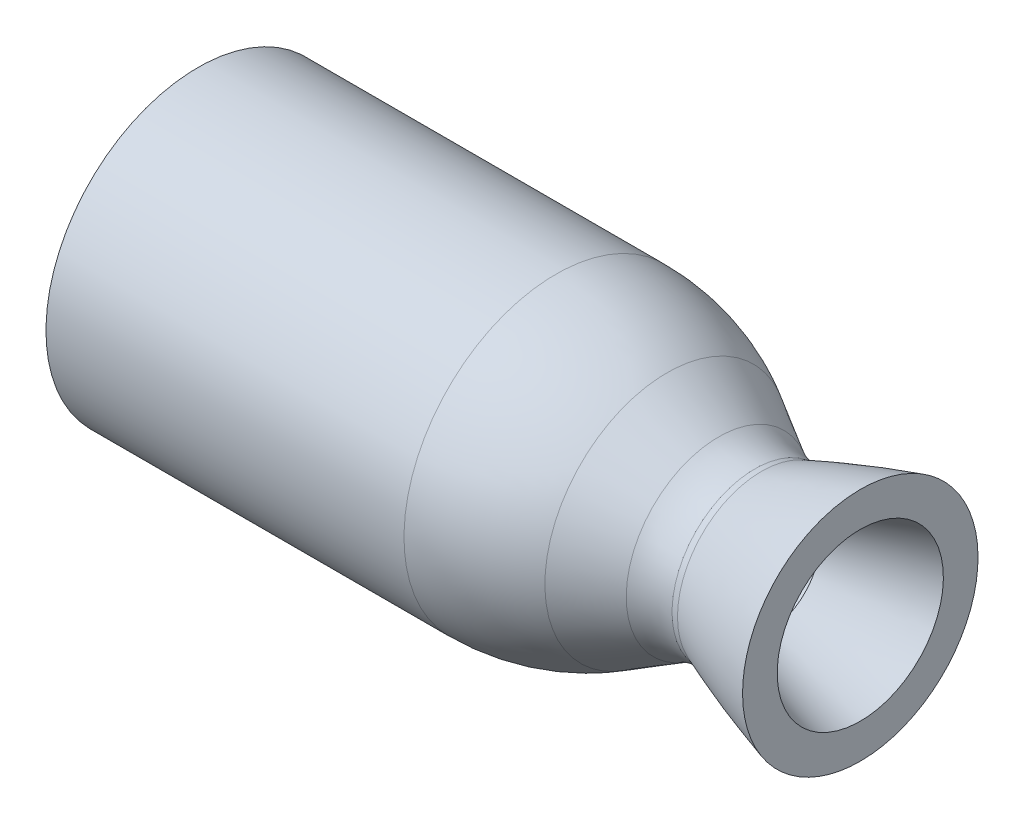
from build123d import *

# Parameters (mm, degrees)
SKETCH1_W = 37.875561449
SKETCH1_H = 61.587456953
SKETCH2_W = 307.951090162
SKETCH2_H = 19.0499659


with BuildPart() as part:
    # Model → Revolve2 (revolve)
    with BuildSketch(Plane.XY):
        with BuildLine():
            Line((37.9852936, 43.0586642), (169.3032936, 43.0586642))
            ThreePointArc((169.3032936, 43.0586642), (190.401848402, 40.280985836), (210.062572, 32.1372484))
            Line((210.062572, 32.1372484), (228.979018864, 21.215832711))
            ThreePointArc((228.979018864, 21.215832711), (235.369964452, 18.568616337), (242.228293864, 17.665700111))
            ThreePointArc((242.228293864, 17.665700111), (243.484699194, 17.783691074), (244.697169154, 18.133537926))
            add(Edge.make_bspline(
                [(244.697169154, 18.133537926), (271.417135664, 28.637280911), (296.809134664, 34.644355511)],
                knots=[0, 0, 0, 1, 1, 1], degree=2))
            Line((296.809134664, 34.644355511), (297.879592264, 34.897593511))
            Line((297.879592264, 34.897593511), (296.809134664, 47.344355511))
            add(Edge.make_bspline(
                [(244.697169154, 30.833537926), (271.417135664, 41.337280911), (296.809134664, 47.344355511)],
                knots=[0, 0, 0, 1, 1, 1], degree=2))
            Line((244.697169154, 30.833537926), (242.228293864, 30.365700111))
            ThreePointArc((242.228293864, 30.365700111), (235.369964452, 31.268616337), (228.979018864, 33.915832711))
            Line((228.979018864, 33.915832711), (210.062572, 44.8372484))
            ThreePointArc((210.062572, 44.8372484), (190.401848402, 52.980985836), (169.3032936, 55.7586642))
            Line((169.3032936, 55.7586642), (37.9852936, 55.7586642))
            Line((37.9852936, 55.7586642), (37.9852936, 43.0586642))
        make_face()
    revolve(axis=Axis((0, -3.5841e-05, 0), (1.0, 5.8642917188933536e-09, 0)))

    # Sketch1 → Cut-Revolve1 (revolve, cut)
    with BuildSketch(Plane.XY):
        with Locations((299.848811079, 30.793694284)):
            Rectangle(SKETCH1_W, SKETCH1_H)
    revolve(axis=Axis((280.911030354, -3.4193e-05, 0), (1, 0, 0)), mode=Mode.SUBTRACT)

    # Sketch2 → Cut-Revolve2 (revolve, cut)
    with BuildSketch(Plane.XY):
        with Locations((153.975545081, 9.52498295)):
            Rectangle(SKETCH2_W, SKETCH2_H)
    revolve(axis=Axis((0, 0, 0), (1, 0, 0)), mode=Mode.SUBTRACT)


solid = part.part
